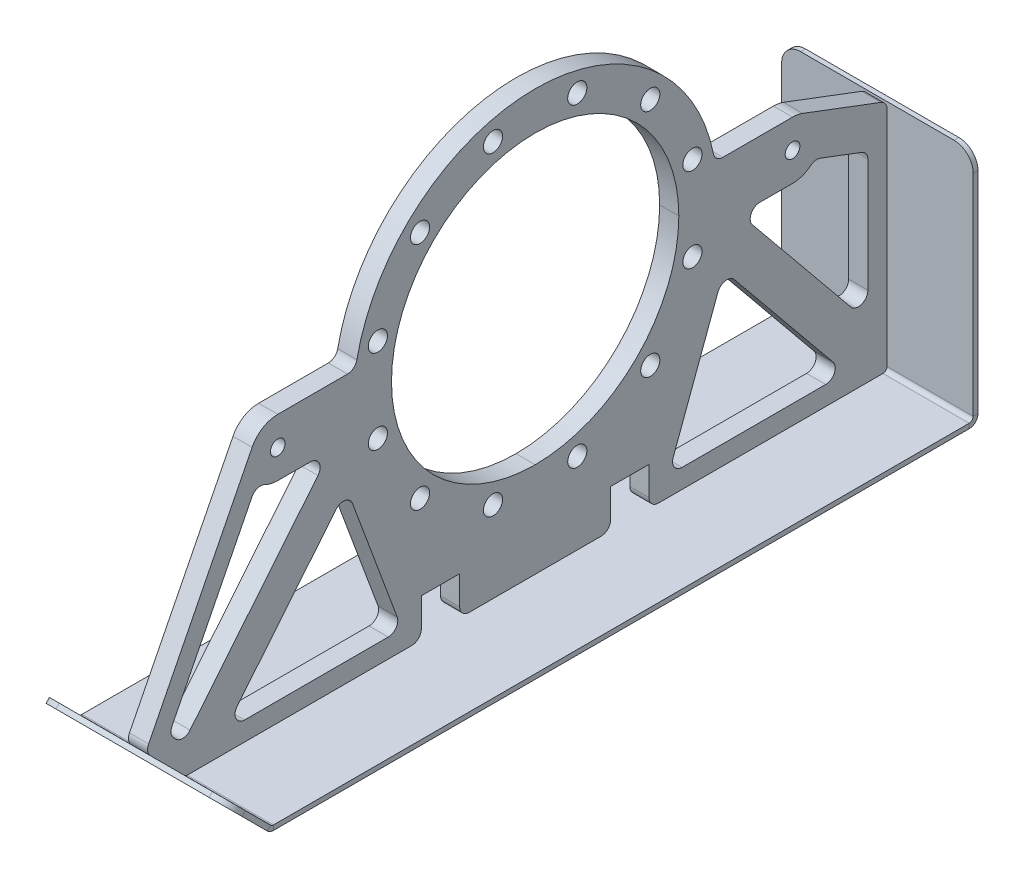
from build123d import *

# Parameters (mm, degrees)
FLANGE_PROFILE_DEPTH                = 12.7
F_7_8_1_DIAMETER_HOLE1_D            = 25.4
BOLT_PATTERN_COUNT                  = 12
SKETCH15_R                          = 9.72312
BOSS_EXTRUDE1_DEPTH                 = 12.7
SKETCH5_W                           = 254
SKETCH5_H                           = 1317.865260112
BASE_SKID_DEPTH                     = 6.35
BEND_START                          = -127
BEND_HEEL_DEPTH                     = 254
BEND_HEEL_2_DEPTH                   = 254
BEND_TOE_DEPTH                      = 254
BEND_TOE_2_DEPTH                    = 254
WEBBING_EXTRUDE_DEPTH               = 12.7
WEBBING_FILLET_R                    = 12.7
SKID_START                          = -472.929130056
SKID_EDGES_DEPTH                    = 6.35
SKID_START_2                        = -334.061851681
SKID_EDGES_2_DEPTH                  = 6.35
FLANGE_FILLET_R                     = 12.7
CONVERT_START                       = -12.7
CONVERT_FLANGE_TO_SHEET_OUTLINE_R   = 12.7
CONVERT_FLANGE_TO_SHEET_OUTLINE_R_2 = 9.72312
CONVERT_FLANGE_TO_SHEET_OUTLINE_R_3 = 190.5
CONVERT_FLANGE_TO_SHEET_DEPTH       = 25.4


# Read off the part's stored shape, not the designer's step: Bend Heel, Bend Toe, Skid Edges, Convert Flange to Sheet
# Sheet-metal steps are written as plain solids
with BuildPart() as part:
    # Sketch1 → Flange Profile (new, symmetric)
    with BuildSketch(Plane(origin=(0, 0, 0), x_dir=(0, 0, -1), z_dir=(1, 0, 0))):
        with BuildLine():
            ThreePointArc((-190.5, 316.3), (0, 506.8), (190.5, 316.3))
            Line((190.5, 316.3), (241.3, 316.3))
            ThreePointArc((241.3, 316.3), (0, 557.6), (-241.3, 316.3))
            Line((-241.3, 316.3), (-190.5, 316.3))
        make_face()
        with BuildLine():
            Line((241.3, 316.3), (190.5, 316.3))
            ThreePointArc((190.5, 316.3), (0, 125.8), (-190.5, 316.3))
            Line((-190.5, 316.3), (-241.3, 316.3))
            ThreePointArc((-241.3, 316.3), (0, 75), (241.3, 316.3))
        make_face()
    extrude(amount=FLANGE_PROFILE_DEPTH, both=True)

    # 7/8 (1) Diameter Hole1 (through all)
    with Locations(Plane(origin=(12.7, 260.420968162, -208.543385896), x_dir=(0, 0, 1), z_dir=(1, 0, 0))):
        with Locations((0, 0)):
            f_7_8_1_diameter_hole1 = Hole(F_7_8_1_DIAMETER_HOLE1_D / 2)

    # Bolt Pattern: 7/8 (1) Diameter Hole1 ×12 about axis
    bolt_pattern_axis = Axis((0, 316.3, 0), (1, 0, 0))
    for i in range(1, BOLT_PATTERN_COUNT):
        add(f_7_8_1_diameter_hole1.rotate(bolt_pattern_axis, i * 360 / BOLT_PATTERN_COUNT), mode=Mode.SUBTRACT)

    # Sketch15 → Boss-Extrude1 (add, symmetric)
    with BuildSketch(Plane(origin=(0, 0, 0), x_dir=(0, 0, -1), z_dir=(1, 0, 0))):
        with BuildLine():
            Line((-238.273120599, 278.2), (-341.3, 278.2))
            ThreePointArc((-341.3, 278.2), (-379.4, 316.3), (-341.3, 354.4))
            Line((-341.3, 354.4), (-238.273120599, 354.4))
            ThreePointArc((-238.273120599, 354.4), (-200.173120599, 316.3), (-238.273120599, 278.2))
        make_face()
        with Locations((-341.3, 316.3)):
            Circle(SKETCH15_R, mode=Mode.SUBTRACT)
    boss_extrude1 = extrude(amount=BOSS_EXTRUDE1_DEPTH, both=True)

    # Mirror2: Boss-Extrude1 across plane
    add(boss_extrude1.mirror(Plane.XY))

    # webbing → Webbing Extrude (add, symmetric)
    with BuildSketch(Plane(origin=(0, 0, 0), x_dir=(0, 0, -1), z_dir=(1, 0, 0))):
        with BuildLine():
            ThreePointArc((238.273120599, 278.2), (0, 75), (-238.273120599, 278.2))
            Line((-238.273120599, 278.2), (-271.07641131, 278.2))
            Line((-271.07641131, 278.2), (-466.535353829, 39.001833116))
            Line((-466.535353829, 39.001833116), (-485.744094857, 58.210574144))
            Line((-485.744094857, 58.210574144), (-380.664844281, 266.473711409))
            Line((-380.664844281, 266.473711409), (-368.819522655, 289.950695021))
            ThreePointArc((-368.819522655, 289.950695021), (-378.982374479, 310.674286388), (-375.315537192, 333.462553119))
            Line((-375.315537192, 333.462553119), (-516.69946035, 53.244915153))
            Line((-516.69946035, 53.244915153), (-465.016837626, 1.562292429))
            ThreePointArc((-465.016837626, 1.562292429), (-463.286363484, 0.406026574), (-461.245130056, 0))
            Line((-461.245130056, 0), (-150.9, 0))
            Line((-150.9, 0), (-150.9, 50.8))
            Line((-150.9, 50.8), (-100.1, 50.8))
            Line((-100.1, 50.8), (-100.1, 0))
            Line((-100.1, 0), (100.1, 0))
            Line((100.1, 0), (100.1, 50.8))
            Line((100.1, 50.8), (150.9, 50.8))
            Line((150.9, 50.8), (150.9, 0))
            Line((150.9, 0), (461.245130056, 0))
            ThreePointArc((461.245130056, 0), (465.016837626, 1.562292429), (466.579130056, 5.334))
            Line((466.579130056, 5.334), (466.579130056, 309.66453199))
            Line((466.579130056, 309.66453199), (354.774573435, 351.937702939))
            ThreePointArc((354.774573435, 351.937702939), (378.177611201, 325.873494246), (370.408024073, 291.716816021))
            Line((370.408024073, 291.716816021), (441.179130056, 264.958344347))
            Line((441.179130056, 264.958344347), (441.179130056, 70.03219769))
            Line((441.179130056, 70.03219769), (271.07641131, 278.2))
            Line((271.07641131, 278.2), (238.273120599, 278.2))
        make_face()
        Polygon((-176.613153751, 25.4), (-412.046717792, 25.4), (-250.076782577, 223.615088522), align=None, mode=Mode.SUBTRACT)
        Polygon((250.076782577, 223.615088522), (412.046717792, 25.4), (176.613153751, 25.4), align=None, mode=Mode.SUBTRACT)
    extrude(amount=WEBBING_EXTRUDE_DEPTH, both=True)

    # Webbing Fillet
    webbing_fillet_edges = [part.edges().sort_by_distance(p)[0] for p in [
        (0, 223.615088522, 250.076782577),
        (0, 25.4, -412.046717792),
        (0, 25.4, -176.613153751),
        (0, 289.950695021, 368.819522655),
        (0, 291.716816021, -370.408024073),
        (0, 264.958344347, -441.179130056),
        (0, 70.03219769, -441.179130056),
        (0, 278.2, -271.07641131),
        (0, 278.2, 271.07641131),
        (0, 39.001833116, 466.535353829),
        (0, 223.615088522, -250.076782577),
        (0, 58.210574144, 485.744094857),
        (0, 25.4, 176.613153751),
        (0, 25.4, 412.046717792),
    ]]
    fillet(webbing_fillet_edges, radius=WEBBING_FILLET_R)

    # Flange Fillet
    flange_fillet_edges = [part.edges().sort_by_distance(p)[0] for p in [
        (0, 53.244915153, 516.69946035),
        (0, 0, 150.9),
        (0, 0, 100.1),
        (0, 0, -100.1),
        (0, 0, -150.9),
        (0, 309.66453199, -466.579130056),
        (0, 354.4, 238.273120599),
        (0, 354.4, -238.273120599),
    ]]
    fillet(flange_fillet_edges, radius=FLANGE_FILLET_R)


with BuildPart() as body_2:
    # Sketch5 → Base Skid (new body)
    with BuildSketch(Plane(origin=(0, 0, 0), x_dir=(1, 0, 0), z_dir=(0, 1, 0))):
        with Locations((0, 118.6125)):
            Rectangle(SKETCH5_W, SKETCH5_H)
    extrude(amount=-BASE_SKID_DEPTH)

    # Bend Heel outline → Bend Heel (cut)
    with BuildSketch(Plane.YZ.offset(BEND_START)):
        with BuildLine():
            Line((0, -777.545130056), (0, -471.640528076))
            ThreePointArc((0, -471.640528076), (-4.636915504, -467.33583609), (-6.35, -461.245130056))
            Line((-6.35, -461.245130056), (-6.35, -777.545130056))
            Line((-6.35, -777.545130056), (0, -777.545130056))
        make_face()
    extrude(amount=BEND_HEEL_DEPTH, mode=Mode.SUBTRACT)

    # Bend Heel 2 outline → Bend Heel 2 (add)
    with BuildSketch(Plane.YZ.offset(BEND_START)):
        with BuildLine():
            Line((5.334, -472.929130056), (309.66453199, -472.929130056))
            Line((309.66453199, -472.929130056), (309.66453199, -466.579130056))
            Line((309.66453199, -466.579130056), (5.334, -466.579130056))
            ThreePointArc((5.334, -466.579130056), (1.56229243, -465.016837626), (0, -461.245130056))
            Line((0, -461.245130056), (0, -471.640528076))
            ThreePointArc((0, -471.640528076), (2.590277571, -472.602411563), (5.334, -472.929130056))
        make_face()
    extrude(amount=BEND_HEEL_2_DEPTH)

    # Bend Toe outline → Bend Toe (cut)
    with BuildSketch(Plane.YZ.offset(BEND_START)):
        with BuildLine():
            Line((-6.35, 540.320130056), (-6.35, 461.245130056))
            ThreePointArc((-6.35, 461.245130056), (-5.460608458, 465.71640328), (-2.927835631, 469.506965687))
            Line((-2.927835631, 469.506965687), (0, 472.434801318))
            Line((0, 472.434801318), (0, 540.320130056))
            Line((0, 540.320130056), (-6.35, 540.320130056))
        make_face()
    extrude(amount=BEND_TOE_DEPTH, mode=Mode.SUBTRACT)

    # Bend Toe 2 outline → Bend Toe 2 (add)
    with BuildSketch(Plane.YZ.offset(BEND_START)):
        with BuildLine():
            Line((48.754787092, 521.189588411), (0, 472.434801318))
            Line((0, 472.434801318), (0, 461.245130056))
            ThreePointArc((0, 461.245130056), (0.406026574, 463.286363484), (1.562292429, 465.016837626))
            Line((1.562292429, 465.016837626), (53.244915153, 516.69946035))
            Line((53.244915153, 516.69946035), (48.754787092, 521.189588411))
        make_face()
    extrude(amount=BEND_TOE_2_DEPTH)

    # Skid Edges outline → Skid Edges (cut)
    with BuildSketch(Plane.XY.offset(SKID_START)):
        with BuildLine():
            ThreePointArc((-127, 284.26453199), (-119.560512242, 302.225044232), (-101.6, 309.66453199))
            Line((-101.6, 309.66453199), (-127, 309.66453199))
            Line((-127, 309.66453199), (-127, 284.26453199))
        make_face()
        with BuildLine():
            ThreePointArc((101.6, 309.66453199), (119.560512242, 302.225044232), (127, 284.26453199))
            Line((127, 284.26453199), (127, 309.66453199))
            Line((127, 309.66453199), (101.6, 309.66453199))
        make_face()
    extrude(amount=SKID_EDGES_DEPTH, mode=Mode.SUBTRACT)

    # Skid Edges 2 outline → Skid Edges 2 (cut)
    with BuildSketch(Plane(origin=(0, 0, 0), x_dir=(1, 0, 0), z_dir=(0, 0.707106781186546, -0.707106781186549)).offset(SKID_START_2)):
        with BuildLine():
            Line((-127, -403.011532817), (-101.6, -403.011532817))
            ThreePointArc((-101.6, -403.011532817), (-119.560512242, -395.572045059), (-127, -377.611532817))
            Line((-127, -377.611532817), (-127, -403.011532817))
        make_face()
        with BuildLine():
            ThreePointArc((127, -377.611532817), (119.560512242, -395.572045059), (101.6, -403.011532817))
            Line((101.6, -403.011532817), (127, -403.011532817))
            Line((127, -403.011532817), (127, -377.611532817))
        make_face()
    extrude(amount=SKID_EDGES_2_DEPTH, mode=Mode.SUBTRACT)


with BuildPart() as body_3:
    # Convert Flange to Sheet outline → Convert Flange to Sheet (new body)
    with BuildSketch(Plane.YZ.offset(CONVERT_START)):
        with BuildLine():
            ThreePointArc((354.4, 341.3), (348.746134391, 361.271438683), (333.462553119, 375.315537192))
            Line((333.462553119, 375.315537192), (61.448595688, 512.560290001))
            ThreePointArc((61.448595688, 512.560290001), (53.716209529, 513.761463663), (46.747488527, 510.202033725))
            Line((46.747488527, 510.202033725), (1.562292429, 465.016837626))
            ThreePointArc((1.562292429, 465.016837626), (0.406026574, 463.286363484), (0, 461.245130056))
            Line((0, 461.245130056), (0, 163.6))
            ThreePointArc((0, 163.6), (3.719743879, 154.619743879), (12.7, 150.9))
            Line((12.7, 150.9), (50.8, 150.9))
            Line((50.8, 150.9), (50.8, 100.1))
            Line((50.8, 100.1), (12.7, 100.1))
            ThreePointArc((12.7, 100.1), (3.719743879, 96.380256121), (0, 87.4))
            Line((0, 87.4), (0, -87.4))
            ThreePointArc((0, -87.4), (3.719743879, -96.380256121), (12.7, -100.1))
            Line((12.7, -100.1), (50.8, -100.1))
            Line((50.8, -100.1), (50.8, -150.9))
            Line((50.8, -150.9), (12.7, -150.9))
            ThreePointArc((12.7, -150.9), (3.719743879, -154.619743879), (0, -163.6))
            Line((0, -163.6), (0, -461.245130056))
            ThreePointArc((0, -461.245130056), (1.56229243, -465.016837626), (5.334, -466.579130056))
            Line((5.334, -466.579130056), (300.888912587, -466.579130056))
            ThreePointArc((300.888912587, -466.579130056), (308.108595375, -464.327392133), (312.7681469, -458.370654534))
            Line((312.7681469, -458.370654534), (351.937702939, -354.774573435))
            ThreePointArc((351.937702939, -354.774573435), (353.779370872, -348.148850927), (354.4, -341.3))
            Line((354.4, -341.3), (354.4, -248.868157867))
            ThreePointArc((354.4, -248.868157867), (357.262622301, -240.83597261), (364.56, -236.424749973))
            ThreePointArc((364.56, -236.424749973), (557.6, 0), (364.56, 236.424749973))
            ThreePointArc((364.56, 236.424749973), (357.262622301, 240.83597261), (354.4, 248.868157867))
            Line((354.4, 248.868157867), (354.4, 341.3))
        make_face()
        with BuildLine():
            ThreePointArc((46.135994814, -395.102459099), (32.65790179, -396.74310345), (25.4, -385.26819312))
            Line((25.4, -385.26819312), (25.4, -194.864301774))
            ThreePointArc((25.4, -194.864301774), (30.846114958, -184.439756133), (42.513567213, -182.955883556))
            Line((42.513567213, -182.955883556), (202.817491303, -242.368656148))
            ThreePointArc((202.817491303, -242.368656148), (210.931253322, -252.189965766), (206.439918904, -264.111340345))
            Line((206.439918904, -264.111340345), (46.135994814, -395.102459099))
        make_face(mode=Mode.SUBTRACT)
        with BuildLine():
            ThreePointArc((257.464005186, -288.020670003), (270.94209821, -286.380025652), (278.2, -297.854935982))
            Line((278.2, -297.854935982), (278.2, -341.3))
            ThreePointArc((278.2, -341.3), (280.417487243, -354.108406547), (286.811825631, -365.42586936))
            ThreePointArc((286.811825631, -365.42586936), (289.515915106, -371.417982957), (288.861668487, -377.959350292))
            Line((288.861668487, -377.959350292), (268.061959257, -432.970654534))
            ThreePointArc((268.061959257, -432.970654534), (263.402407732, -438.927392133), (256.182724944, -441.179130056))
            Line((256.182724944, -441.179130056), (105.645109911, -441.179130056))
            ThreePointArc((105.645109911, -441.179130056), (93.682978455, -432.744972415), (97.609115097, -418.644864077))
            Line((97.609115097, -418.644864077), (257.464005186, -288.020670003))
        make_face(mode=Mode.SUBTRACT)
        with Locations((107.756614104, -55.879031838)):
            Circle(CONVERT_FLANGE_TO_SHEET_OUTLINE_R, mode=Mode.SUBTRACT)
        with Locations((163.635645942, -152.664354058)):
            Circle(CONVERT_FLANGE_TO_SHEET_OUTLINE_R, mode=Mode.SUBTRACT)
        with Locations((260.420968162, -208.543385896)):
            Circle(CONVERT_FLANGE_TO_SHEET_OUTLINE_R, mode=Mode.SUBTRACT)
        with Locations((316.3, -341.3)):
            Circle(CONVERT_FLANGE_TO_SHEET_OUTLINE_R_2, mode=Mode.SUBTRACT)
        with Locations((372.179031838, -208.543385896)):
            Circle(CONVERT_FLANGE_TO_SHEET_OUTLINE_R, mode=Mode.SUBTRACT)
        with Locations((316.3, 0)):
            Circle(CONVERT_FLANGE_TO_SHEET_OUTLINE_R_3, mode=Mode.SUBTRACT)
        with Locations((468.964354058, -152.664354058)):
            Circle(CONVERT_FLANGE_TO_SHEET_OUTLINE_R, mode=Mode.SUBTRACT)
        with Locations((524.843385896, -55.879031838)):
            Circle(CONVERT_FLANGE_TO_SHEET_OUTLINE_R, mode=Mode.SUBTRACT)
        with Locations((107.756614104, 55.879031838)):
            Circle(CONVERT_FLANGE_TO_SHEET_OUTLINE_R, mode=Mode.SUBTRACT)
        with Locations((163.635645942, 152.664354058)):
            Circle(CONVERT_FLANGE_TO_SHEET_OUTLINE_R, mode=Mode.SUBTRACT)
        with Locations((260.420968162, 208.543385896)):
            Circle(CONVERT_FLANGE_TO_SHEET_OUTLINE_R, mode=Mode.SUBTRACT)
        with BuildLine():
            Line((46.135994814, 395.102459099), (206.439918904, 264.111340345))
            ThreePointArc((206.439918904, 264.111340345), (210.931253322, 252.189965766), (202.817491303, 242.368656148))
            Line((202.817491303, 242.368656148), (42.513567213, 182.955883556))
            ThreePointArc((42.513567213, 182.955883556), (30.846114958, 184.439756133), (25.4, 194.864301774))
            Line((25.4, 194.864301774), (25.4, 385.26819312))
            ThreePointArc((25.4, 385.26819312), (32.65790179, 396.74310345), (46.135994814, 395.102459099))
        make_face(mode=Mode.SUBTRACT)
        with BuildLine():
            ThreePointArc((282.284462808, 358.462553119), (279.235178626, 350.120941928), (278.2, 341.3))
            Line((278.2, 341.3), (278.2, 297.854935982))
            ThreePointArc((278.2, 297.854935982), (270.94209821, 286.380025652), (257.464005186, 288.020670003))
            Line((257.464005186, 288.020670003), (49.87538072, 457.650118027))
            ThreePointArc((49.87538072, 457.650118027), (45.227339921, 466.847798927), (48.931119413, 476.464640127))
            Line((48.931119413, 476.464640127), (51.713147519, 479.246668232))
            ThreePointArc((51.713147519, 479.246668232), (58.68186852, 482.80609817), (66.414254679, 481.604924508))
            Line((66.414254679, 481.604924508), (276.666801451, 375.521916556))
            ThreePointArc((276.666801451, 375.521916556), (283.00874198, 368.155690599), (282.284462808, 358.462553119))
        make_face(mode=Mode.SUBTRACT)
        with Locations((372.179031838, 208.543385896)):
            Circle(CONVERT_FLANGE_TO_SHEET_OUTLINE_R, mode=Mode.SUBTRACT)
        with Locations((524.843385896, 55.879031838)):
            Circle(CONVERT_FLANGE_TO_SHEET_OUTLINE_R, mode=Mode.SUBTRACT)
        with Locations((468.964354058, 152.664354058)):
            Circle(CONVERT_FLANGE_TO_SHEET_OUTLINE_R, mode=Mode.SUBTRACT)
        with Locations((316.3, 341.3)):
            Circle(CONVERT_FLANGE_TO_SHEET_OUTLINE_R_2, mode=Mode.SUBTRACT)
    extrude(amount=CONVERT_FLANGE_TO_SHEET_DEPTH)


solid = Compound([body_2.part, body_3.part])
